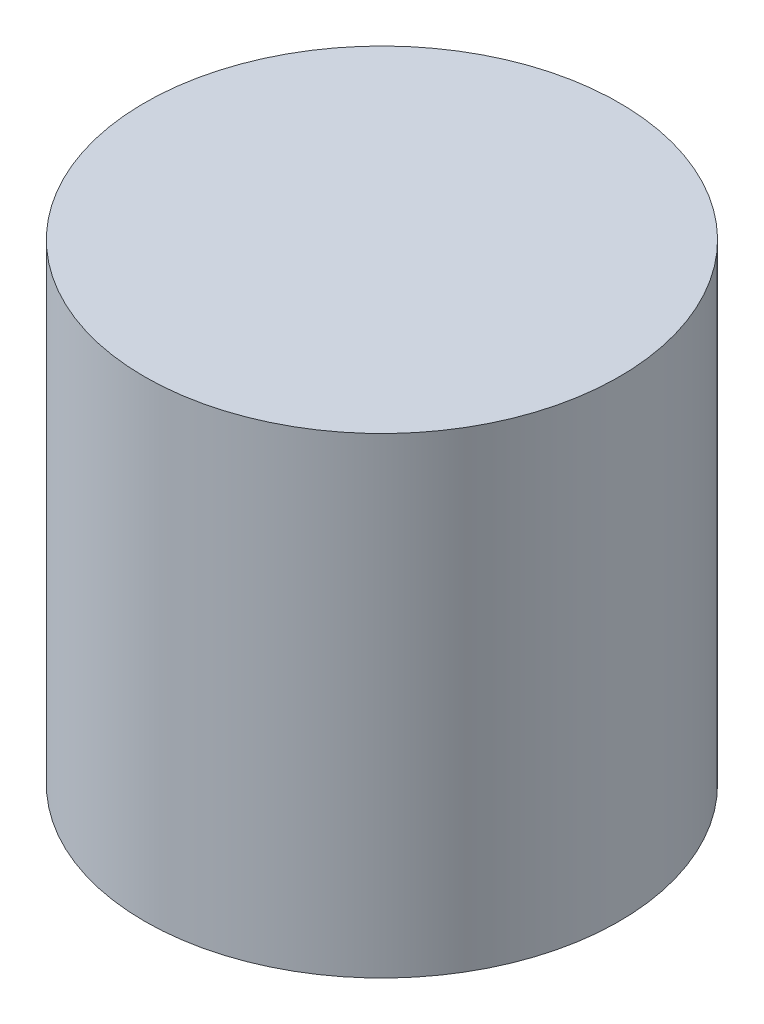
from build123d import *

# Parameters (mm, degrees)
SKETCH1_R           = 3.937
BOSS_EXTRUDE1_DEPTH = 7.8232


with BuildPart() as part:
    # Sketch1 → Boss-Extrude1 (new body)
    with BuildSketch(Plane(origin=(0, 0, 0), x_dir=(1, 0, 0), z_dir=(0, 1, 0))):
        Circle(SKETCH1_R)
    extrude(amount=BOSS_EXTRUDE1_DEPTH)


solid = part.part
